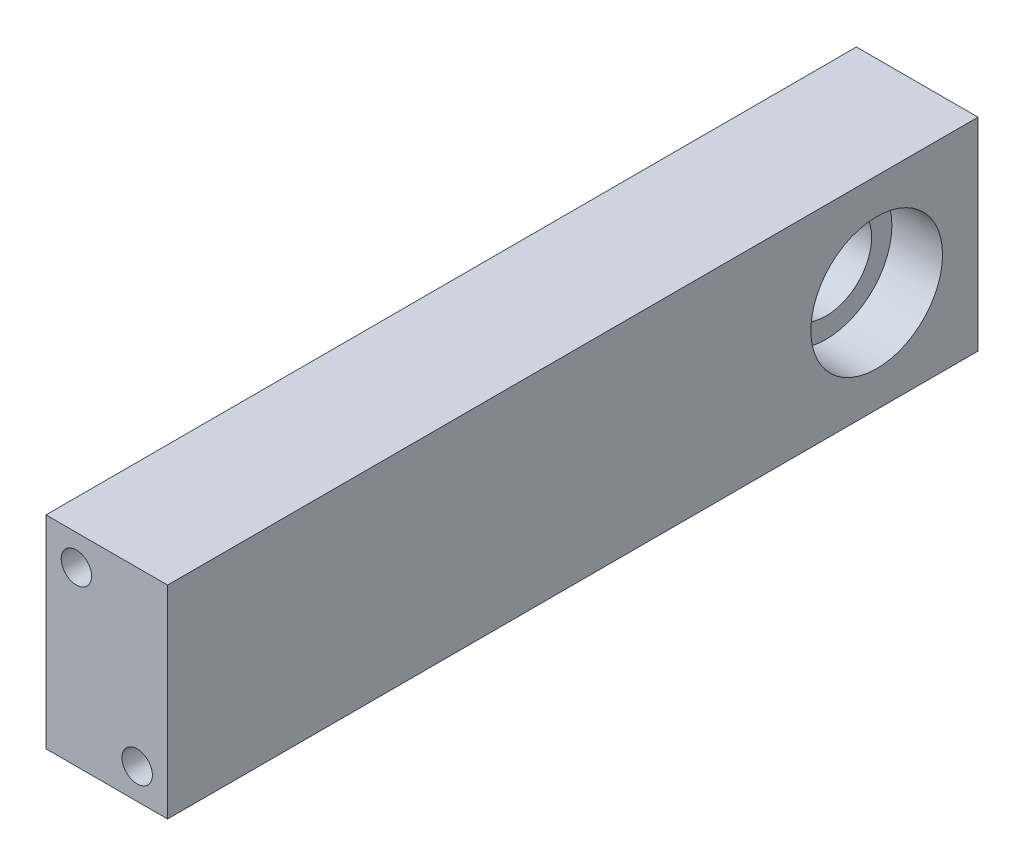
from build123d import *

# Parameters (mm, degrees)
SZKIC1_W                    = 12
SZKIC1_H                    = 20
DODANIE_WYCI_GNI_CIE1_DEPTH = 80
SZKIC2_R                    = 1.5
WYTNIJ_WYCI_GNI_CIE1_DEPTH  = 10
SZKIC4_R                    = 6.5
WYTNIJ_WYCI_GNI_CIE2_DEPTH  = 5
SZKIC5_R                    = 4.5
WYTNIJ_WYCI_GNI_CIE3_DEPTH  = 82.510735489


with BuildPart() as part:
    # Szkic1 → Dodanie-wyciągnięcie1 (new body)
    with BuildSketch(Plane.XY):
        Rectangle(SZKIC1_W, SZKIC1_H)
    extrude(amount=DODANIE_WYCI_GNI_CIE1_DEPTH)

    # Szkic2 → Wytnij-wyciągnięcie1 (cut)
    with BuildSketch(Plane.XY.offset(80)):
        with Locations((-3, 7)):
            Circle(SZKIC2_R)
        with Locations((3, -7)):
            Circle(SZKIC2_R)
    extrude(amount=-WYTNIJ_WYCI_GNI_CIE1_DEPTH, mode=Mode.SUBTRACT)

    # Szkic4 → Wytnij-wyciągnięcie2 (cut)
    with BuildSketch(Plane(origin=(6, 0, 0), x_dir=(0, 0, -1), z_dir=(1, 0, 0))):
        with Locations((-10, 0)):
            Circle(SZKIC4_R)
    extrude(amount=-WYTNIJ_WYCI_GNI_CIE2_DEPTH, mode=Mode.SUBTRACT)

    # Szkic5 → Wytnij-wyciągnięcie3 (cut, through all)
    with BuildSketch(Plane.ZY.offset(6)):
        with Locations((10, 0)):
            Circle(SZKIC5_R)
    extrude(amount=-WYTNIJ_WYCI_GNI_CIE3_DEPTH, mode=Mode.SUBTRACT)


solid = part.part
